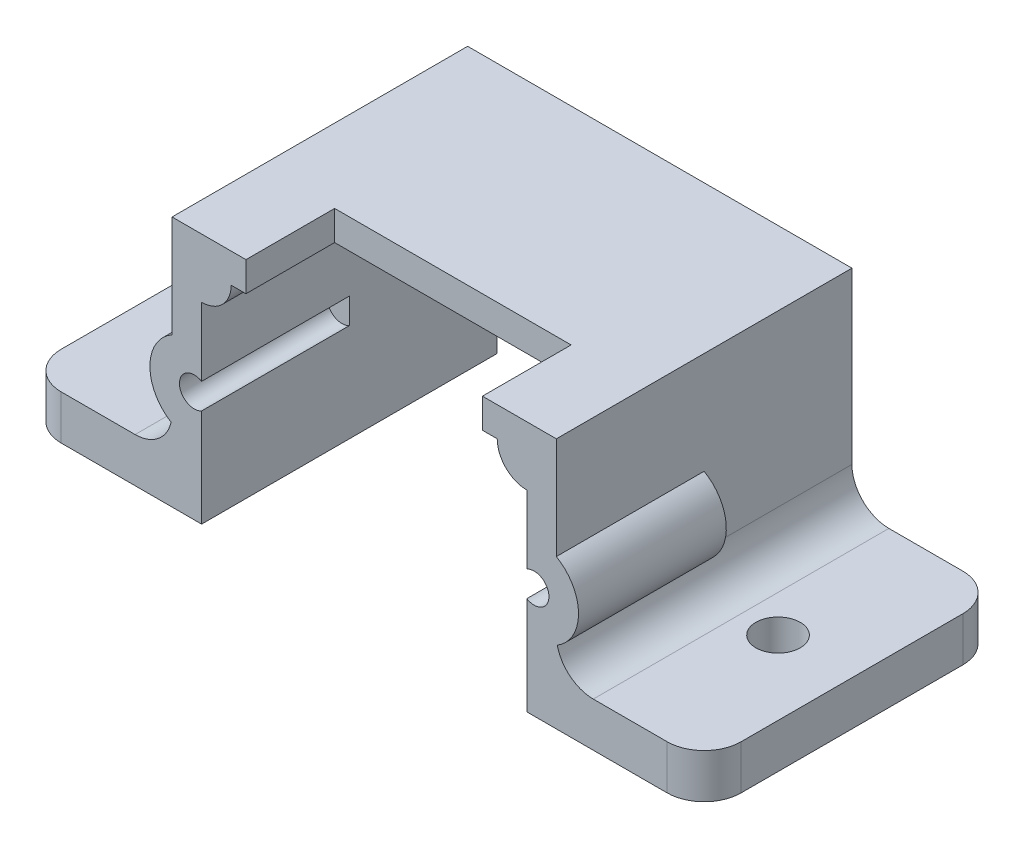
from build123d import *

# Parameters (mm, degrees)
EXTRUDE_1_DEPTH     = 20
CUT_EXTRUDE_1_DEPTH = 20
EXTRUDE_2_DEPTH     = 12.5
SKETCH_4_W          = 4.208324297
SKETCH_4_H          = 5.852484321
SKETCH_4_W_2        = 6.809838445
SKETCH_4_H_2        = 5.603711631
CUT_EXTRUDE_2_DEPTH = 10
EXTRUDE_3_DEPTH     = 10
SKETCH_6_W          = 10
SKETCH_6_H          = 20
EXTRUDE_4_DEPTH     = 3
SKETCH_7_R          = 1.5
CUT_EXTRUDE_3_DEPTH = 3
FILLET_1_R          = 2.5


with BuildPart() as part:
    # 草图1 → 凸台-拉伸1 (new body)
    with BuildSketch(Plane.XY):
        with BuildLine():
            Line((-15.073529412, 6.665686275), (10.926470588, 6.665686275))
            Line((10.926470588, 6.665686275), (10.926470588, -0.236237514))
            ThreePointArc((10.926470588, -0.236237514), (12.426470588, -2.834313725), (10.926470588, -5.432389937))
            Line((10.926470588, -5.432389937), (10.926470588, -10.334313725))
            Line((10.926470588, -10.334313725), (8.926470588, -10.334313725))
            Line((8.926470588, -10.334313725), (8.926470588, -3.700339129))
            ThreePointArc((8.926470588, -3.700339129), (10.426470588, -2.834313725), (8.926470588, -1.968288322))
            Line((8.926470588, -1.968288322), (8.926470588, 4.665686275))
            Line((8.926470588, 4.665686275), (-13.073529412, 4.665686275))
            Line((-13.073529412, 4.665686275), (-13.073529412, -1.968288322))
            ThreePointArc((-13.073529412, -1.968288322), (-14.573529412, -2.834313725), (-13.073529412, -3.700339129))
            Line((-13.073529412, -3.700339129), (-13.073529412, -10.334313725))
            Line((-13.073529412, -10.334313725), (-15.073529412, -10.334313725))
            Line((-15.073529412, -10.334313725), (-15.073529412, -5.432389937))
            ThreePointArc((-15.073529412, -5.432389937), (-16.573529412, -2.834313725), (-15.073529412, -0.236237514))
            Line((-15.073529412, -0.236237514), (-15.073529412, 6.665686275))
        make_face()
    extrude(amount=EXTRUDE_1_DEPTH)

    # 草图2 → 切除-拉伸1 (cut)
    with BuildSketch(Plane(origin=(0, 6.665686275, 0), x_dir=(1, 0, 0), z_dir=(0, 1, 0))):
        Polygon((-2.073529412, -14), (-10.073529412, -14), (-10.073529412, -20), (5.926470588, -20), (5.926470588, -14), align=None)
    extrude(amount=-CUT_EXTRUDE_1_DEPTH, mode=Mode.SUBTRACT)

    # 草图3 → 凸台-拉伸2 (add)
    with BuildSketch(Plane.XY.offset(20)):
        with BuildLine():
            Line((-13.073529412, 4.665686275), (-13.073529412, 2.665686275))
            ThreePointArc((-13.073529412, 2.665686275), (-11.659315849, 3.251472712), (-11.073529412, 4.665686275))
            Line((-11.073529412, 4.665686275), (-13.073529412, 4.665686275))
        make_face()
        with BuildLine():
            Line((8.926470588, 4.665686275), (8.926470588, 2.665686275))
            ThreePointArc((8.926470588, 2.665686275), (7.512257026, 3.251472712), (6.926470588, 4.665686275))
            Line((6.926470588, 4.665686275), (8.926470588, 4.665686275))
        make_face()
    extrude(amount=-EXTRUDE_2_DEPTH)

    # 草图4 → 切除-拉伸2 (cut)
    with BuildSketch(Plane(origin=(0, 0, 0), x_dir=(-1, 0, 0), z_dir=(0, 0, -1))):
        with Locations((-13.030632737, -3.162479675)):
            Rectangle(SKETCH_4_W, SKETCH_4_H)
        with Locations((18.478448635, -3.03809333)):
            Rectangle(SKETCH_4_W_2, SKETCH_4_H_2)
    extrude(amount=-CUT_EXTRUDE_2_DEPTH, mode=Mode.SUBTRACT)

    # 草图5 → 凸台-拉伸3 (add)
    with BuildSketch(Plane(origin=(0, 0, 0), x_dir=(-1, 0, 0), z_dir=(0, 0, -1))):
        with BuildLine():
            Line((-8.926470588, -1.968288322), (-8.926470588, -3.700339129))
            ThreePointArc((-8.926470588, -3.700339129), (-10.426470588, -2.834313725), (-8.926470588, -1.968288322))
        make_face()
        with BuildLine():
            Line((13.073529412, -1.968288322), (13.073529412, -3.700339129))
            ThreePointArc((13.073529412, -3.700339129), (14.573529412, -2.834313725), (13.073529412, -1.968288322))
        make_face()
    extrude(amount=-EXTRUDE_3_DEPTH)

    # 草图6 → 凸台-拉伸4 (add)
    with BuildSketch(Plane.XZ.offset(10.334313725)):
        with Locations((15.926470588, 10)):
            Rectangle(SKETCH_6_W, SKETCH_6_H)
        with Locations((-20.073529412, 10)):
            Rectangle(SKETCH_6_W, SKETCH_6_H)
    extrude(amount=-EXTRUDE_4_DEPTH)

    # 草图7 → 切除-拉伸3 (cut)
    with BuildSketch(Plane(origin=(0, -7.334313725, 0), x_dir=(1, 0, 0), z_dir=(0, 1, 0))):
        with Locations((15.926470588, -10)):
            Circle(SKETCH_7_R)
        with Locations((-20.073529412, -10)):
            Circle(SKETCH_7_R)
    extrude(amount=-CUT_EXTRUDE_3_DEPTH, mode=Mode.SUBTRACT)

    # 圆角1
    fillet_1_edges = [part.edges().sort_by_distance(p)[0] for p in [
        (-15.073529412, -7.334313725, 10),
        (10.926470588, -7.334313725, 10),
        (20.926470588, -8.834313725, 20),
        (-25.073529412, -8.834313725, 20),
        (20.926470588, -8.834313725, 0),
        (-25.073529412, -8.834313725, 0),
    ]]
    fillet(fillet_1_edges, radius=FILLET_1_R)


solid = part.part
